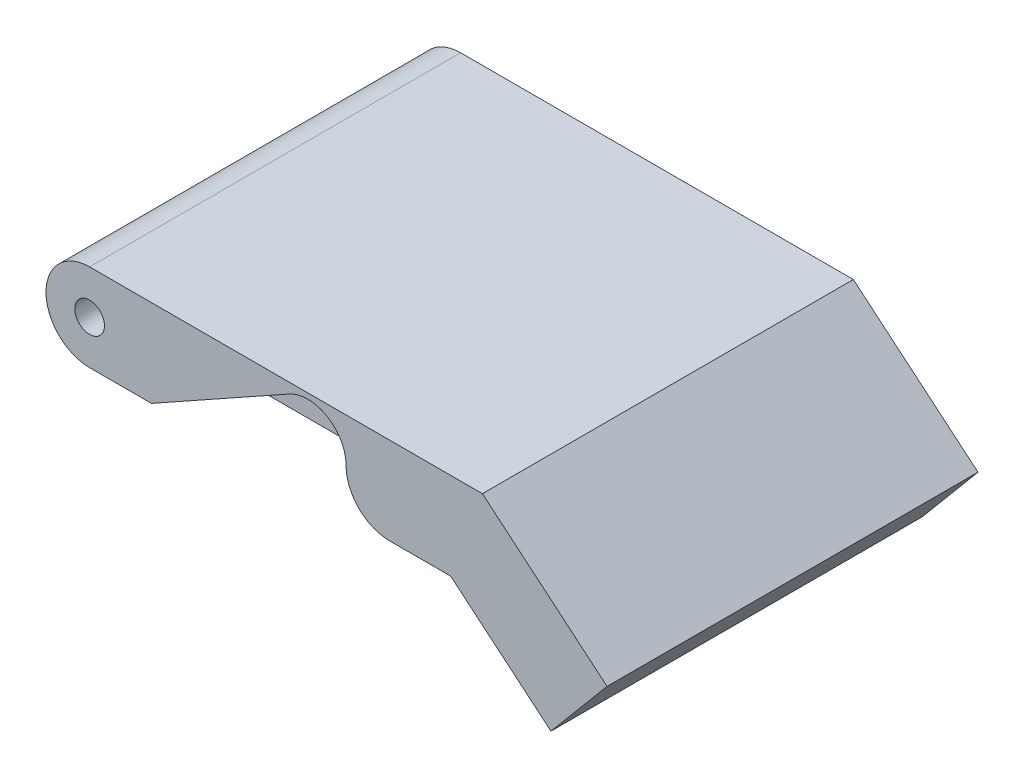
from build123d import *

# Parameters (mm, degrees)
BOSS_EXTRUDE1_DEPTH = 26.9875
SKETCH2_R           = 2.159
SKETCH2_R_2         = 1.905
CUT_EXTRUDE1_DEPTH  = 95.481629649
CUT_EXTRUDE2_DEPTH  = 9.525


with BuildPart() as part:
    # Sketch1 → Boss-Extrude1 (new, symmetric)
    with BuildSketch(Plane.XY):
        with BuildLine():
            Line((0, 6.35), (57.15, 6.35))
            Line((57.15, 6.35), (75.284127309, -8.866339537))
            Line((75.284127309, -8.866339537), (67.120724666, -18.595103965))
            Line((67.120724666, -18.595103965), (52.527578025, -6.35))
            Line((52.527578025, -6.35), (0, -6.35))
            ThreePointArc((0, -6.35), (-6.35, 0), (0, 6.35))
        make_face()
    extrude(amount=BOSS_EXTRUDE1_DEPTH, both=True)

    # Sketch2 → Cut-Extrude1 (cut, through all)
    with BuildSketch(Plane.XY.offset(26.9875)):
        Circle(SKETCH2_R)
        with Locations((31.75, 0)):
            Circle(SKETCH2_R_2)
    extrude(amount=-CUT_EXTRUDE1_DEPTH, mode=Mode.SUBTRACT)

    # Sketch3 → Cut-Extrude2 (cut)
    with BuildSketch(Plane.XY.offset(26.9875)):
        with BuildLine():
            Line((43.65625, -6.35), (8.996738518, -6.35))
            Line((8.996738518, -6.35), (29.039560706, 4.850302351))
            ThreePointArc((29.039560706, 4.850302351), (34.561764191, 4.792274637), (37.30625, 0))
            ThreePointArc((37.30625, 0), (39.166121939, -4.490128061), (43.65625, -6.35))
        make_face()
    cut_extrude2 = extrude(amount=-CUT_EXTRUDE2_DEPTH, mode=Mode.SUBTRACT)

    # Mirror1: Cut-Extrude2 across plane
    add(cut_extrude2.mirror(Plane.XY), mode=Mode.SUBTRACT)


solid = part.part
